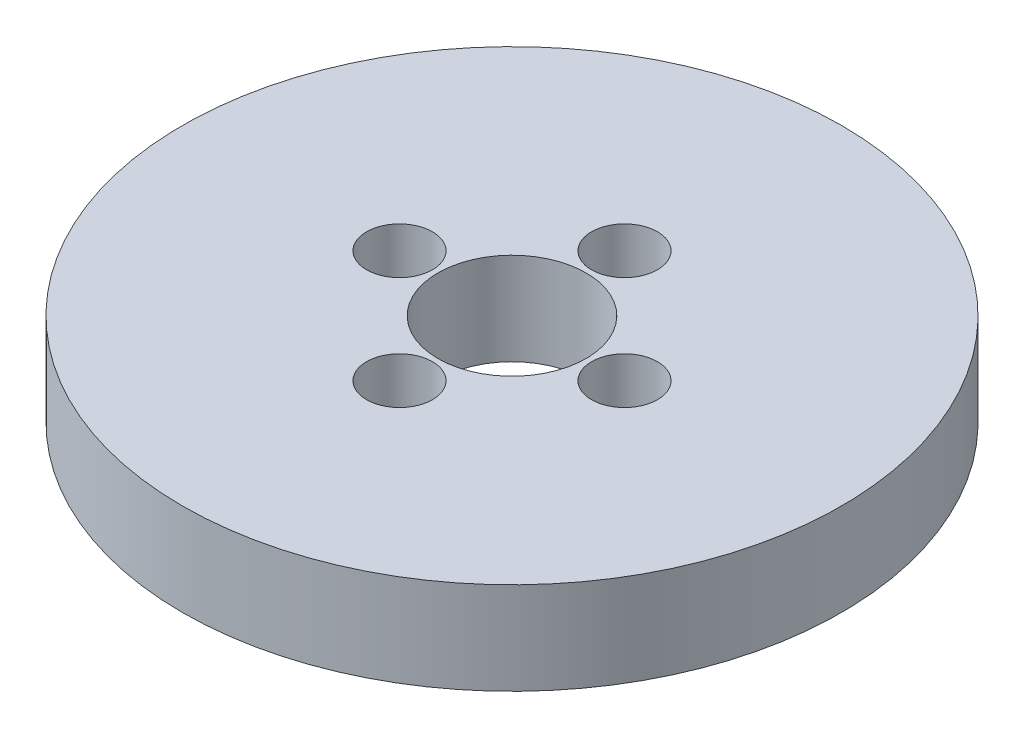
from build123d import *

# Parameters (mm, degrees)
SKETCH1_R           = 100
BOSS_EXTRUDE1_DEPTH = 28
SKETCH2_R           = 22.5
CUT_EXTRUDE1_DEPTH  = 145.166570328
SKETCH3_R           = 10
CUT_EXTRUDE2_DEPTH  = 22.818948915
CIRPATTERN1_COUNT   = 4


with BuildPart() as part:
    # Sketch1 → Boss-Extrude1 (new body)
    with BuildSketch(Plane(origin=(0, 0, 0), x_dir=(1, 0, 0), z_dir=(0, 1, 0))):
        Circle(SKETCH1_R)
    extrude(amount=BOSS_EXTRUDE1_DEPTH)

    # Sketch2 → Cut-Extrude1 (cut, through all)
    with BuildSketch(Plane(origin=(0, 0, 0), x_dir=(1, 0, 0), z_dir=(0, 1, 0))):
        Circle(SKETCH2_R)
    extrude(amount=CUT_EXTRUDE1_DEPTH, mode=Mode.SUBTRACT)

    # Sketch3 → Cut-Extrude2 (cut)
    with BuildSketch(Plane(origin=(0, 28, 0), x_dir=(1, 0, 0), z_dir=(0, 1, 0))):
        with Locations((-34.137032786, 0)):
            Circle(SKETCH3_R)
    cut_extrude2 = extrude(amount=-CUT_EXTRUDE2_DEPTH, mode=Mode.SUBTRACT)

    # CirPattern1: Cut-Extrude2 ×4 about axis
    cirpattern1_axis = Axis((0, 0, 0), (0, 1, 0))
    for i in range(1, CIRPATTERN1_COUNT):
        add(cut_extrude2.rotate(cirpattern1_axis, i * 360 / CIRPATTERN1_COUNT), mode=Mode.SUBTRACT)


solid = part.part
